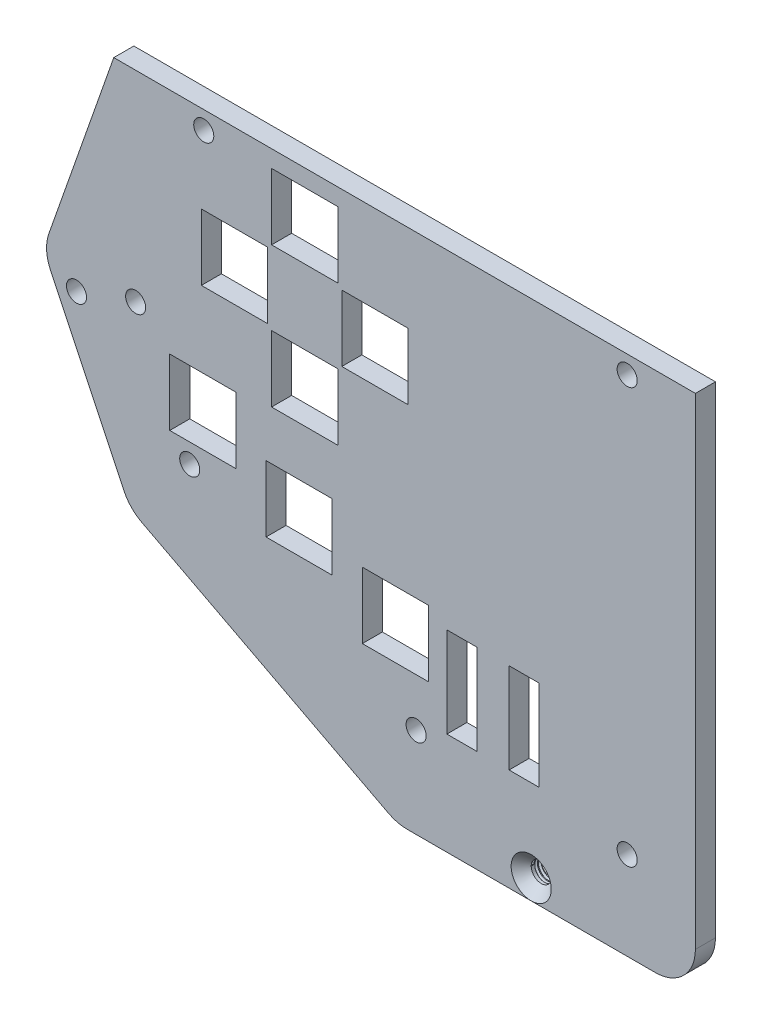
from build123d import *

# Parameters (mm, degrees)
BOSS_EXTRUDE1_DEPTH     = 2.54
CUT_EXTRUDE1_DEPTH      = 112.420336115
CUT_EXTRUDE1_DEPTH_BACK = 112.420336115
SKETCH11_W              = 3.81
SKETCH11_H              = 11.43
SKETCH11_W_2            = 8.382
SKETCH11_H_2            = 8.382
CUT_EXTRUDE2_DEPTH      = 112.420336115
CUT_EXTRUDE2_DEPTH_BACK = 112.420336115
SKETCH12_R              = 1.27
CUT_EXTRUDE3_DEPTH      = 112.420336115
CUT_EXTRUDE3_DEPTH_BACK = 112.420336115
SKETCH13_R              = 1.27
CHAMFER1_SIZE           = 1.27
THREAD1_PITCH           = 0.453571429


with BuildPart() as part:
    # Sketch10 → Boss-Extrude1 (new body)
    with BuildSketch(Plane.XY):
        with BuildLine():
            Line((53.34, -31.75), (53.34, -92.71))
            ThreePointArc((53.34, -92.71), (51.852102448, -96.302102448), (48.26, -97.79))
            Line((48.26, -97.79), (16.846989059, -97.79))
            ThreePointArc((16.846989059, -97.79), (15.638688158, -97.644208035), (14.499741809, -97.215200367))
            Line((14.499741809, -97.215200367), (-16.7505185, -80.933552139))
            ThreePointArc((-16.7505185, -80.933552139), (-18.059258376, -79.955412607), (-18.989802686, -78.61241436))
            Line((-18.989802686, -78.61241436), (-28.309569459, -59.040904135))
            ThreePointArc((-28.309569459, -59.040904135), (-28.795802898, -57.127870198), (-28.51617555, -55.173917704))
            Line((-28.51617555, -55.173917704), (-20.291777778, -31.75))
            Line((-20.291777778, -31.75), (53.34, -31.75))
        make_face()
    extrude(amount=BOSS_EXTRUDE1_DEPTH)

    # Sketch11 → Cut-Extrude1 (cut, two sides: drawn at the far end of the back side and taken through both)
    with BuildSketch(Plane.XY.offset(2.54).offset(-CUT_EXTRUDE1_DEPTH_BACK)):
        with Locations((31.65602, -79.121)):
            Rectangle(SKETCH11_W, SKETCH11_H)
        with Locations((23.78202, -79.121)):
            Rectangle(SKETCH11_W, SKETCH11_H)
        with Locations((3.878385852, -55.88)):
            Rectangle(SKETCH11_W_2, SKETCH11_H_2)
        with Locations((-5.011614148, -46.99)):
            Rectangle(SKETCH11_W_2, SKETCH11_H_2)
        with Locations((3.878385852, -38.1)):
            Rectangle(SKETCH11_W_2, SKETCH11_H_2)
        with Locations((12.768385852, -46.99)):
            Rectangle(SKETCH11_W_2, SKETCH11_H_2)
        with Locations((-9.017, -64.897)):
            Rectangle(SKETCH11_W_2, SKETCH11_H_2)
        with Locations((3.175, -70.485)):
            Rectangle(SKETCH11_W_2, SKETCH11_H_2)
        with Locations((15.367, -76.073)):
            Rectangle(SKETCH11_W_2, SKETCH11_H_2)
    extrude(amount=CUT_EXTRUDE1_DEPTH + CUT_EXTRUDE1_DEPTH_BACK, mode=Mode.SUBTRACT)

    # Sketch12 → Cut-Extrude2 (cut, two sides: drawn at the far end of the back side and taken through both)
    with BuildSketch(Plane(origin=(0, 0, 0), x_dir=(-1, 0, 0), z_dir=(0, 0, -1)).offset(-CUT_EXTRUDE2_DEPTH_BACK)):
        with Locations((-44.704, -34.036)):
            Circle(SKETCH12_R)
        with Locations((8.902417778, -34.036)):
            Circle(SKETCH12_R)
        with Locations((17.526, -57.15)):
            Circle(SKETCH12_R)
        with Locations((-44.704, -86.614)):
            Circle(SKETCH12_R)
        with Locations((-17.98483871, -86.36)):
            Circle(SKETCH12_R)
        with Locations((10.676516232, -71.533915913)):
            Circle(SKETCH12_R)
    extrude(amount=CUT_EXTRUDE2_DEPTH + CUT_EXTRUDE2_DEPTH_BACK, mode=Mode.SUBTRACT)

    # Sketch13 → Cut-Extrude3 (cut, two sides: drawn at the far end of the back side and taken through both)
    with BuildSketch(Plane(origin=(0, 0, 0), x_dir=(-1, 0, 0), z_dir=(0, 0, -1)).offset(-CUT_EXTRUDE3_DEPTH_BACK)):
        with Locations((25.012261453, -59.761967182)):
            Circle(SKETCH13_R)
        with Locations((-32.55349453, -95.25)):
            Circle(SKETCH13_R)
    extrude(amount=CUT_EXTRUDE3_DEPTH + CUT_EXTRUDE3_DEPTH_BACK, mode=Mode.SUBTRACT)

    # Chamfer1
    chamfer1_edges = [part.edges().sort_by_distance(p)[0] for p in [
        (33.82349453, -95.25, 2.54),
    ]]
    chamfer(chamfer1_edges, length=CHAMFER1_SIZE)

    # Thread1: the profile of Thread Profile1 profile screwed along a right-hand helix of 14 turns, 6 arcs to a turn; built about Z, then put on its axis
    thread1_z = Axis((0, 0, 0), (0, 0, 1))
    thread1_corners = [(1.2697, 0, -0.000173205), (1.515502736, 0, 0.141741071), (1.515502736, 0, 0.198437499), (1.2697, 0, 0.340351775)]
    with BuildLine(mode=Mode.PRIVATE) as thread1_profile:
        Line(thread1_corners[0], thread1_corners[1])
        Line(thread1_corners[1], thread1_corners[2])
        Line(thread1_corners[2], thread1_corners[3])
        Line(thread1_corners[3], thread1_corners[0])
    thread1_cap = Face(thread1_profile.wire())
    thread1_turn_angles = [0, 30, 60, 90, 120, 150, 180, 210, 240, 270, 300, 330, 360]
    thread1_turn_weights = [1, 0.8660254037844387, 1, 0.8660254037844387, 1, 0.8660254037844387, 1, 0.8660254037844387, 1, 0.8660254037844387, 1, 0.8660254037844387, 1]
    thread1_turn_rails = [Edge.make_bspline([Vector(p[0], p[1], 0).rotate(thread1_z, thread1_turn_angles[k]) / thread1_turn_weights[k] + Vector(0, 0, p[2] + THREAD1_PITCH * thread1_turn_angles[k] / 360) for k in range(13)], [0, 0, 0, 1, 1, 2, 2, 3, 3, 4, 4, 5, 5, 6, 6, 6], 2, thread1_turn_weights) for p in thread1_corners]
    thread1_turn_sides = [Face.make_surface_from_curves(thread1_turn_rails[p[0]], thread1_turn_rails[p[1]]) for p in [(0, 1), (1, 2), (2, 3), (3, 0)]]
    thread1 = Plane(origin=(32.55349453, -95.25, 1.27), x_dir=(-1, 0, 0), z_dir=(0, 0, -1)) * Solid(Shell([*[p.moved(Location((0, 0, THREAD1_PITCH * i))) for i in range(14) for p in thread1_turn_sides], thread1_cap, thread1_cap.rotate(thread1_z, 5040).moved(Location((0, 0, THREAD1_PITCH * 5040 / 360)))]))
    add(thread1, mode=Mode.SUBTRACT)


solid = part.part
